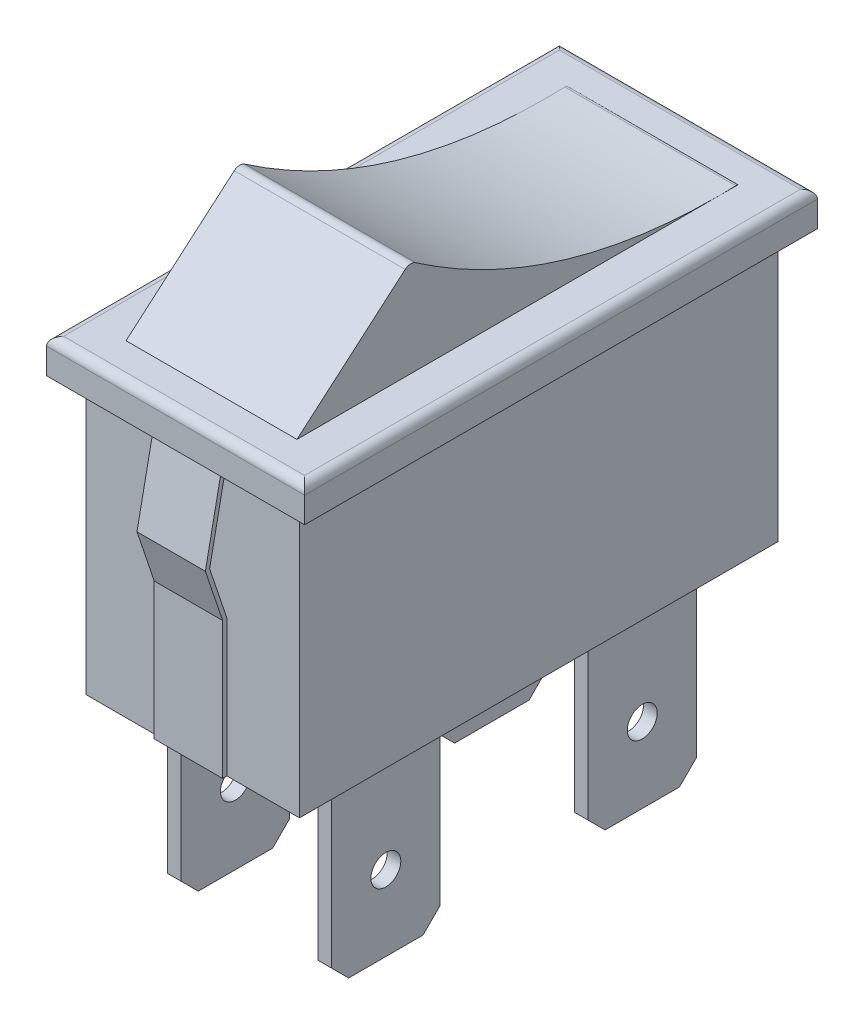
from build123d import *

# Parameters (mm, degrees)
SKETCH1_W                  = 12.5
SKETCH1_H                  = 28
BOSS_EXTRUDE1_DEPTH        = 16
SKETCH2_W                  = 15.1
SKETCH2_H                  = 30
BOSS_EXTRUDE2_DEPTH        = 2
FILLET1_R                  = 0.5
SKETCH3_W                  = 10
SKETCH3_H                  = 25.8
BOSS_EXTRUDE3_DEPTH        = 5.7
CUT_EXTRUDE1_DEPTH         = 31.727715502
CUT_EXTRUDE1_DEPTH_BACK    = 31.727715502
FILLET2_R                  = 0.5
FILLET3_R                  = 0.4
BOSS_EXTRUDE4_DEPTH        = 2
BOSS_EXTRUDE4_DEPTH_BACK   = 2
BOSS_EXTRUDE4_2_DEPTH      = 2
BOSS_EXTRUDE4_2_DEPTH_BACK = 2
SKETCH9_W                  = 0.8
SKETCH9_H                  = 6.35
BOSS_EXTRUDE5_DEPTH        = 11
CHAMFER1_SIZE              = 1
SKETCH10_R                 = 0.875
CUT_EXTRUDE2_DEPTH         = 31.673042539


with BuildPart() as part:
    # Sketch1 → Boss-Extrude1 (new body)
    with BuildSketch(Plane(origin=(0, 0, 0), x_dir=(1, 0, 0), z_dir=(0, 1, 0))):
        Rectangle(SKETCH1_W, SKETCH1_H)
    extrude(amount=BOSS_EXTRUDE1_DEPTH)

    # Sketch2 → Boss-Extrude2 (add)
    with BuildSketch(Plane(origin=(0, 16, 0), x_dir=(1, 0, 0), z_dir=(0, 1, 0))):
        Rectangle(SKETCH2_W, SKETCH2_H)
    extrude(amount=BOSS_EXTRUDE2_DEPTH)

    # Fillet1
    fillet1_edges = [part.edges().sort_by_distance(p)[0] for p in [
        (7.55, 18, 0),
        (0, 18, -15),
        (-7.55, 18, 0),
        (0, 18, 15),
    ]]
    fillet(fillet1_edges, radius=FILLET1_R)

    # Sketch3 → Boss-Extrude3 (add)
    with BuildSketch(Plane(origin=(0, 18, 0), x_dir=(1, 0, 0), z_dir=(0, 1, 0))):
        Rectangle(SKETCH3_W, SKETCH3_H)
    extrude(amount=BOSS_EXTRUDE3_DEPTH)

    # Sketch4 → Cut-Extrude1 (cut, two sides: drawn at the far end of the back side and taken through both)
    with BuildSketch(Plane(origin=(5, 0, 0), x_dir=(0, 0, -1), z_dir=(1, 0, 0)).offset(-CUT_EXTRUDE1_DEPTH_BACK)):
        Polygon((-12.9, 23.7), (-12.9, 18), (-6.277278159, 23.7), align=None)
        with BuildLine():
            Line((12.9, 23.7), (-6.277278159, 23.7))
            add(Edge.make_bspline(
                [(-6.277278159, 23.7), (2.345374626, 17.640478228), (12.9, 18.022676474)],
                knots=[0, 0, 0, 1, 1, 1], degree=2))
            Line((12.9, 18.022676474), (12.9, 23.7))
        make_face()
    extrude(amount=CUT_EXTRUDE1_DEPTH + CUT_EXTRUDE1_DEPTH_BACK, mode=Mode.SUBTRACT)

    # Fillet2
    fillet2_edges = [part.edges().sort_by_distance(p)[0] for p in [
        (0, 23.7, 6.277278159),
    ]]
    fillet(fillet2_edges, radius=FILLET2_R)

    # Fillet3
    # the kernel refuses this fillet: 0.4 mm, written as the material it takes off along each edge
    with BuildSketch(Plane(origin=(5.331871434, 18.022676474, -12.9), x_dir=(0, -0.034291988848172396, 0.9994118567942032), z_dir=(-1, 0, 0))) as fillet3_piece_1:
        with BuildLine():
            CenterArc((0.133508314, -0.399999278), FILLET3_R, 90.108824788, 19.270863365)
            Line((0.000777621, -0.022663137), (-0.001876992, -0.015116415))
            ThreePointArc((-0.001876992, -0.015116415), (-0.007606484, -0.011605905), (-0.007995295, -0.000274336))
            Line((-0.007995295, -0.000274336), (1.5175e-05, 0.007999986))
            ThreePointArc((1.5175e-05, 0.007999986), (0.066374292, 0.007937006), (0.132733379, 0.007999986))
            Line((0.132733379, 0.007999986), (0.132748574, 0))
        make_face()
    extrude(amount=10.663742869, mode=Mode.SUBTRACT)

    # Sketch9 → Boss-Extrude5 (add)
    with BuildSketch(Plane.XZ):
        with Locations((-4.4, 7.5)):
            Rectangle(SKETCH9_W, SKETCH9_H)
        with Locations((-4.4, -7.5)):
            Rectangle(SKETCH9_W, SKETCH9_H)
        with Locations((4.4, -7.5)):
            Rectangle(SKETCH9_W, SKETCH9_H)
        with Locations((4.4, 7.5)):
            Rectangle(SKETCH9_W, SKETCH9_H)
    extrude(amount=BOSS_EXTRUDE5_DEPTH)

    # Chamfer1
    chamfer1_edges = [part.edges().sort_by_distance(p)[0] for p in [
        (-4.4, -11, 4.325),
        (-4.4, -11, 10.675),
        (-4.4, -11, -10.675),
        (-4.4, -11, -4.325),
        (4.4, -11, -4.325),
        (4.4, -11, -10.675),
        (4.4, -11, 10.675),
        (4.4, -11, 4.325),
    ]]
    chamfer(chamfer1_edges, length=CHAMFER1_SIZE)

    # Sketch10 → Cut-Extrude2 (cut, through all)
    with BuildSketch(Plane(origin=(4.8, 0, 0), x_dir=(0, 0, -1), z_dir=(1, 0, 0))):
        with Locations((-7.5, -6.6)):
            Circle(SKETCH10_R)
        with Locations((7.5, -6.6)):
            Circle(SKETCH10_R)
    extrude(amount=-CUT_EXTRUDE2_DEPTH, mode=Mode.SUBTRACT)


with BuildPart() as body_2:
    # Sketch8 → Boss-Extrude4 (new, two sides: drawn at the far end of the back side and taken through both)
    with BuildSketch(Plane(origin=(0, 0, 0), x_dir=(0, 0, -1), z_dir=(1, 0, 0)).offset(-BOSS_EXTRUDE4_DEPTH_BACK)):
        Polygon((-14, 16), (-14.25, 16), (-15.259050703, 11), (-14.25, 8), (-14.25, 0), (-14, 0), (-14, 8), (-15.009050703, 11), align=None)
    extrude(amount=BOSS_EXTRUDE4_DEPTH + BOSS_EXTRUDE4_DEPTH_BACK)


with BuildPart() as body_3:
    # Sketch8 → Boss-Extrude4 2 (new, two sides: drawn at the far end of the back side and taken through both)
    with BuildSketch(Plane(origin=(0, 0, 0), x_dir=(0, 0, -1), z_dir=(1, 0, 0)).offset(-BOSS_EXTRUDE4_2_DEPTH_BACK)):
        Polygon((14.25, 0), (14.25, 8), (15.259050703, 11), (14.25, 16), (14, 16), (15.009050703, 11), (14, 8), (14, 0), align=None)
    extrude(amount=BOSS_EXTRUDE4_2_DEPTH + BOSS_EXTRUDE4_2_DEPTH_BACK)


solid = Compound([part.part, body_2.part, body_3.part])
